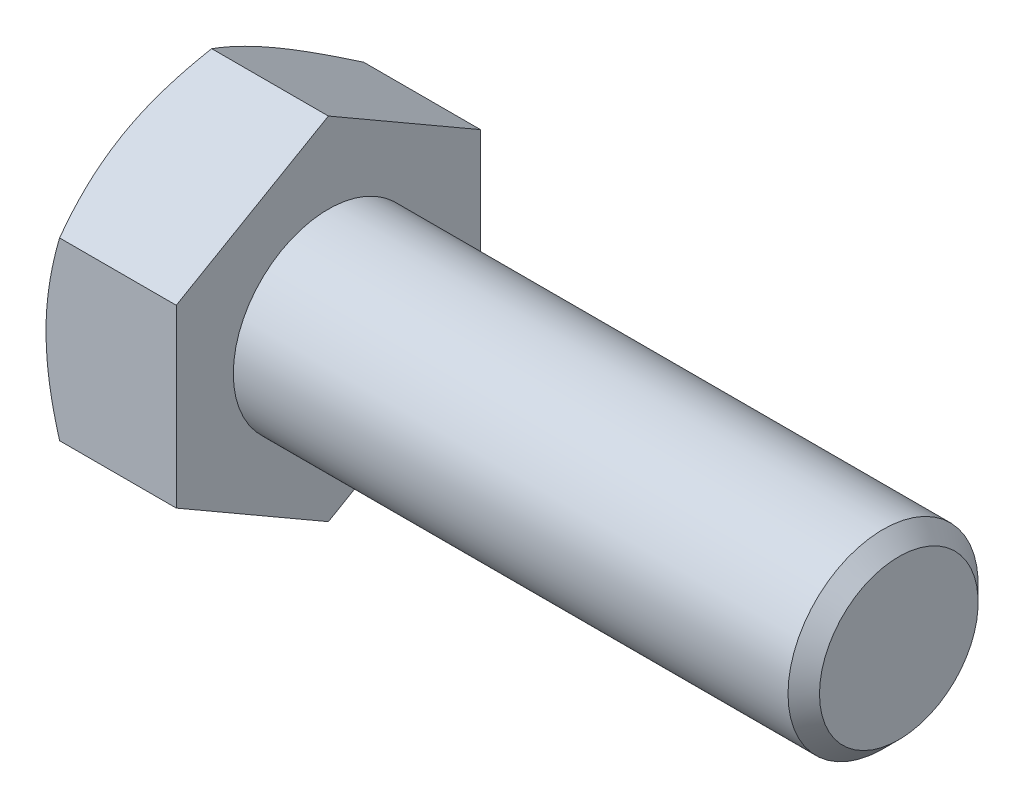
from build123d import *

# Parameters (mm, degrees)
BASEHEAD_DEPTH = 6.85


# Read off the part's stored shape, not the designer's step: HeadChamfer
with BuildPart() as part:
    # Sketch1 → BaseHead (new body)
    with BuildSketch(Plane(origin=(0, 0, 0), x_dir=(0, 0, -1), z_dir=(1, 0, 0))):
        Polygon((8, 4.618802154), (8, -4.618802154), (0, -9.237604307), (-8, -4.618802154), (-8, 4.618802154), (0, 9.237604307), align=None)
    extrude(amount=BASEHEAD_DEPTH)

    # HeadChamfer outline → HeadChamfer (revolve, cut)
    with BuildSketch(Plane.YX):
        Polygon((9.237604311, 0.714531182), (8, 0), (9.237604311, 0), align=None)
    revolve(axis=Axis((0, 0, 0), (1, 0, 0)), mode=Mode.SUBTRACT)

    # HeadChamfer 2 outline → HeadChamfer 2 (revolve)
    with BuildSketch(Plane.YX):
        Polygon((5, 6.85), (5, 36.022), (4.172, 36.85), (0, 36.85), (0, 6.85), align=None)
    revolve(axis=Axis((0, 0, 0), (1, 0, 0)))


solid = part.part
